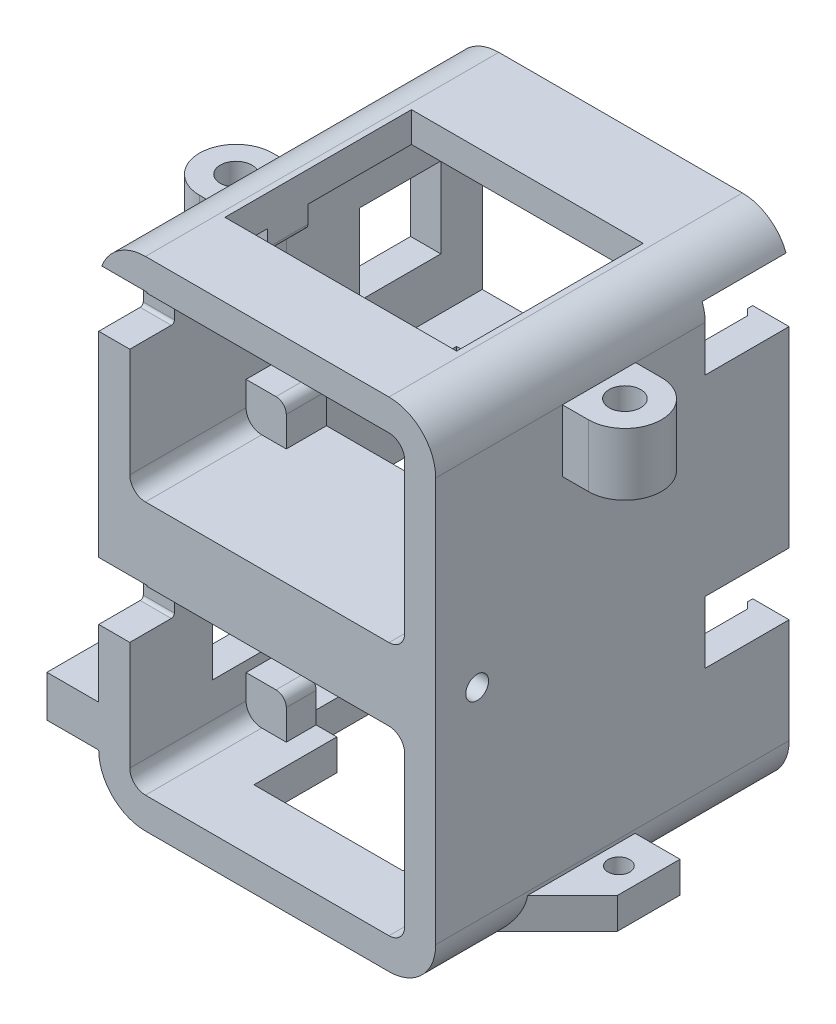
from build123d import *

# Parameters (mm, degrees)
EXTRUDE_2_DEPTH      = 11.22
EXTRUDE_3_DEPTH      = 3.88
CUT_EXTRUDE_1_DEPTH  = 4.65
SKETCH_8_R           = 3.525
SKETCH_8_R_2         = 1.525
EXTRUDE_5_DEPTH      = 6
SKETCH_9_W           = 22.36
SKETCH_9_H           = 3
CUT_EXTRUDE_3_DEPTH  = 8
SKETCH_10_W          = 21.46
SKETCH_10_H          = 6.88
CUT_EXTRUDE_4_DEPTH  = 1
CUT_EXTRUDE_5_DEPTH  = 8
EXTRUDE_7_DEPTH      = 3
SKETCH_15_W          = 26.7
SKETCH_15_H          = 42.2
EXTRUDE_42878_DEPTH  = 19
SKETCH_16_W          = 26.7
SKETCH_16_H          = 6.8
EXTRUDE_9_DEPTH      = 16
CUT_EXTRUDE_8_REACH  = 51.099
SKETCH_17_W          = 19.66
SKETCH_17_H          = 10
CUT_EXTRUDE_9_REACH  = 63.216
SKETCH_18_W          = 8.1
SKETCH_18_H          = 6
CUT_EXTRUDE_START    = -2.91
SKETCH_19_W          = 21.46
SKETCH_19_H          = 1
SKETCH_19_H_2        = 10
CUT_EXTRUDE_10_DEPTH = 2.91
CUT_EXTRUDE_14_REACH = 64.971
SKETCH_24_W          = 14
SKETCH_24_H          = 8
CUT_EXTRUDE_11_REACH = 64.971
SKETCH_20_W          = 22.36
SKETCH_20_H          = 10
SKETCH_21_W          = 1.5
SKETCH_21_H          = 5
EXTRUDE_10_DEPTH     = 0.6
CHAMFER_1_SIZE       = 1
CUT_EXTRUDE_12_REACH = 64.955
SKETCH_22_W          = 15
SKETCH_22_H          = 9.56
SKETCH_22_W_2        = 7.1
SKETCH_22_W_3        = 7.859919518
SKETCH_22_H_2        = 7.76
CUT_EXTRUDE_13_REACH = 64.971
SKETCH_23_W          = 0.38
SKETCH_23_H          = 8
SKETCH_25_R          = 1.05
EXTRUDE_48383_DEPTH  = 3
SKETCH_26_W          = 5
SKETCH_26_H          = 4
EXTRUDE_12_DEPTH     = 7
SKETCH_27_R          = 1.05
CUT_EXTRUDE_15_DEPTH = 57.74919682


with BuildPart() as part:
    # 草图2 → 凸台-拉伸2 (new body)
    with BuildSketch(Plane.XY):
        with BuildLine():
            ThreePointArc((-16.26, -7.25), (-14.939051583, -10.439051583), (-11.75, -11.76))
            Line((-11.75, -11.76), (11.75, -11.76))
            ThreePointArc((11.75, -11.76), (14.939051583, -10.439051583), (16.26, -7.25))
            Line((16.26, -7.25), (16.26, 31.75))
            ThreePointArc((16.26, 31.75), (14.939051583, 34.939051583), (11.75, 36.26))
            Line((11.75, 36.26), (-11.75, 36.26))
            ThreePointArc((-11.75, 36.26), (-14.939051583, 34.939051583), (-16.26, 31.75))
            Line((-16.26, 31.75), (-16.26, -7.25))
        make_face()
        with BuildLine():
            Line((13.26, 7.25), (13.26, -7.25))
            ThreePointArc((13.26, -7.25), (12.81773124, -8.31773124), (11.75, -8.76))
            Line((11.75, -8.76), (-11.75, -8.76))
            ThreePointArc((-11.75, -8.76), (-12.81773124, -8.31773124), (-13.26, -7.25))
            Line((-13.26, -7.25), (-13.26, 7.25))
            ThreePointArc((-13.26, 7.25), (-12.81773124, 8.31773124), (-11.75, 8.76))
            Line((-11.75, 8.76), (11.75, 8.76))
            ThreePointArc((11.75, 8.76), (12.81773124, 8.31773124), (13.26, 7.25))
        make_face(mode=Mode.SUBTRACT)
        with BuildLine():
            Line((-11.75, 33.26), (11.75, 33.26))
            ThreePointArc((11.75, 33.26), (12.81773124, 32.81773124), (13.26, 31.75))
            Line((13.26, 31.75), (13.26, 17.25))
            ThreePointArc((13.26, 17.25), (12.81773124, 16.18226876), (11.75, 15.74))
            Line((11.75, 15.74), (-11.75, 15.74))
            ThreePointArc((-11.75, 15.74), (-12.81773124, 16.18226876), (-13.26, 17.25))
            Line((-13.26, 17.25), (-13.26, 31.75))
            ThreePointArc((-13.26, 31.75), (-12.81773124, 32.81773124), (-11.75, 33.26))
        make_face(mode=Mode.SUBTRACT)
    extrude(amount=-EXTRUDE_2_DEPTH)

    # 草图3 → 凸台-拉伸3 (add)
    with BuildSketch(Plane(origin=(0, 0, -11.22), x_dir=(-1, 0, 0), z_dir=(0, 0, -1))):
        with BuildLine():
            ThreePointArc((11.75, -11.76), (14.939051583, -10.439051583), (16.26, -7.25))
            Line((16.26, -7.25), (16.26, 31.75))
            ThreePointArc((16.26, 31.75), (14.939051583, 34.939051583), (11.75, 36.26))
            Line((11.75, 36.26), (-11.75, 36.26))
            ThreePointArc((-11.75, 36.26), (-14.939051583, 34.939051583), (-16.26, 31.75))
            Line((-16.26, 31.75), (-16.26, -7.25))
            ThreePointArc((-16.26, -7.25), (-14.939051583, -10.439051583), (-11.75, -11.76))
            Line((-11.75, -11.76), (11.75, -11.76))
        make_face()
        with BuildLine():
            Line((13.26, -4.88), (10.37, -4.88))
            ThreePointArc((10.37, -4.88), (9.669964287, -5.169964287), (9.38, -5.87))
            Line((9.38, -5.87), (9.38, -8.76))
            Line((9.38, -8.76), (-9.38, -8.76))
            Line((-9.38, -8.76), (-9.38, -5.87))
            ThreePointArc((-9.38, -5.87), (-9.669964287, -5.169964287), (-10.37, -4.88))
            Line((-10.37, -4.88), (-13.26, -4.88))
            Line((-13.26, -4.88), (-13.26, 6.68))
            Line((-13.26, 6.68), (-11.67, 6.68))
            ThreePointArc((-11.67, 6.68), (-11.323517677, 6.823517677), (-11.18, 7.17))
            Line((-11.18, 7.17), (-11.18, 8.76))
            Line((-11.18, 8.76), (11.18, 8.76))
            Line((11.18, 8.76), (11.18, 7.17))
            ThreePointArc((11.18, 7.17), (11.323517677, 6.823517677), (11.67, 6.68))
            Line((11.67, 6.68), (13.26, 6.68))
            Line((13.26, 6.68), (13.26, -4.88))
        make_face(mode=Mode.SUBTRACT)
        with BuildLine():
            Line((13.26, 31.18), (13.26, 19.62))
            Line((13.26, 19.62), (10.37, 19.62))
            ThreePointArc((10.37, 19.62), (9.669964287, 19.330035713), (9.38, 18.63))
            Line((9.38, 18.63), (9.38, 15.74))
            Line((9.38, 15.74), (-9.38, 15.74))
            Line((-9.38, 15.74), (-9.38, 18.63))
            ThreePointArc((-9.38, 18.63), (-9.669964287, 19.330035713), (-10.37, 19.62))
            Line((-10.37, 19.62), (-13.26, 19.62))
            Line((-13.26, 19.62), (-13.26, 31.18))
            Line((-13.26, 31.18), (-11.67, 31.18))
            ThreePointArc((-11.67, 31.18), (-11.323517677, 31.323517677), (-11.18, 31.67))
            Line((-11.18, 31.67), (-11.18, 33.26))
            Line((-11.18, 33.26), (11.18, 33.26))
            Line((11.18, 33.26), (11.18, 31.67))
            ThreePointArc((11.18, 31.67), (11.323517677, 31.323517677), (11.67, 31.18))
            Line((11.67, 31.18), (13.26, 31.18))
        make_face(mode=Mode.SUBTRACT)
    extrude(amount=EXTRUDE_3_DEPTH)

    # 草图4 → 切除-拉伸1 (cut)
    with BuildSketch(Plane.ZY.offset(16.26)):
        with BuildLine():
            Line((0.1, 8.85), (-4, 8.85))
            ThreePointArc((-4, 8.85), (-4.212132034, 8.762132034), (-4.3, 8.55))
            Line((-4.3, 8.55), (-4.3, 3.55))
            ThreePointArc((-4.3, 3.55), (-4.212132034, 3.337867966), (-4, 3.25))
            Line((-4, 3.25), (0.1, 3.25))
            Line((0.1, 3.25), (0.1, 8.85))
        make_face()
        with BuildLine():
            Line((0.1, 33.35), (-4, 33.35))
            ThreePointArc((-4, 33.35), (-4.212132034, 33.262132034), (-4.3, 33.05))
            Line((-4.3, 33.05), (-4.3, 28.05))
            ThreePointArc((-4.3, 28.05), (-4.212132034, 27.837867966), (-4, 27.75))
            Line((-4, 27.75), (0.1, 27.75))
            Line((0.1, 27.75), (0.1, 33.35))
        make_face()
    extrude(amount=-CUT_EXTRUDE_1_DEPTH, mode=Mode.SUBTRACT)

    # 草图8 → 凸台-拉伸5 (add)
    # profile 1 of 3: a face of its own
    with BuildSketch(Plane(origin=(0, 31.75, 0), x_dir=(1, 0, 0), z_dir=(0, 1, 0))):
        with Locations((18.76, 15.755)):
            Circle(SKETCH_8_R)
        with Locations(Location((18.76, 15.755, 0), (0, 0, 270))):
            Circle(SKETCH_8_R_2, mode=Mode.SUBTRACT)
    # profile 2 of 3: a face of its own
    with BuildSketch(Plane(origin=(0, 31.75, 0), x_dir=(1, 0, 0), z_dir=(0, 1, 0))):
        with BuildLine():
            Line((15.235, 19.28), (15.235, 15.755))
            ThreePointArc((15.235, 15.755), (16.267448596, 18.247551404), (18.76, 19.28))
            Line((18.76, 19.28), (15.235, 19.28))
        make_face()
    # profile 3 of 3: a face of its own
    with BuildSketch(Plane(origin=(0, 31.75, 0), x_dir=(1, 0, 0), z_dir=(0, 1, 0))):
        with BuildLine():
            Line((15.235, 12.23), (18.76, 12.23))
            ThreePointArc((18.76, 12.23), (16.267448596, 13.262448596), (15.235, 15.755))
            Line((15.235, 15.755), (15.235, 12.23))
        make_face()
    extrude_5 = extrude(amount=-EXTRUDE_5_DEPTH)

    # 镜向1: 凸台-拉伸5 across plane
    add(extrude_5.mirror(Plane(origin=(0, 0, 0), x_dir=(0, 0, 1), z_dir=(1, 0, 0))))

    # 草图9 → 切除-拉伸3 (cut)
    with BuildSketch(Plane(origin=(0, 0, -15.1), x_dir=(-1, 0, 0), z_dir=(0, 0, -1))):
        with Locations((0, 34.76)):
            Rectangle(SKETCH_9_W, SKETCH_9_H)
    extrude(amount=-CUT_EXTRUDE_3_DEPTH, mode=Mode.SUBTRACT)

    # 草图10 → 切除-拉伸4 (cut)
    with BuildSketch(Plane(origin=(0, 0, -15.1), x_dir=(-1, 0, 0), z_dir=(0, 0, -1))):
        with Locations((0, -8.32)):
            Rectangle(SKETCH_10_W, SKETCH_10_H)
    extrude(amount=-CUT_EXTRUDE_4_DEPTH, mode=Mode.SUBTRACT)

    # 草图12 → 切除-拉伸5 (cut)
    with BuildSketch(Plane.ZY.offset(16.26)):
        with BuildLine():
            ThreePointArc((-2.9, 12.25), (-4, 13.35), (-5.1, 12.25))
            Line((-5.1, 12.25), (-2.9, 12.25))
        make_face()
        with BuildLine():
            Line((-2.9, 12.25), (-5.1, 12.25))
            ThreePointArc((-5.1, 12.25), (-4, 11.15), (-2.9, 12.25))
        make_face()
    cut_extrude_5 = extrude(amount=-CUT_EXTRUDE_5_DEPTH, mode=Mode.SUBTRACT)

    # 镜向2: 切除-拉伸5 across plane
    add(cut_extrude_5.mirror(Plane(origin=(0, 0, 0), x_dir=(0, 0, 1), z_dir=(1, 0, 0))), mode=Mode.SUBTRACT)

    # 草图14 → 凸台-拉伸7 (add)
    with BuildSketch(Plane(origin=(0, 0, -15.1), x_dir=(-1, 0, 0), z_dir=(0, 0, -1))):
        with BuildLine():
            Line((-16.26, 19.53), (-16.26, 8.85))
            Line((-16.26, 8.85), (-9.83, 8.85))
            Line((-9.83, 8.85), (-9.83, 19.459759001))
            ThreePointArc((-9.83, 19.459759001), (-9.892490797, 19.497228321), (-9.957568187, 19.53))
            Line((-9.957568187, 19.53), (-16.26, 19.53))
        make_face()
        with BuildLine():
            Line((9.83, 8.85), (16.26, 8.85))
            Line((16.26, 8.85), (16.26, 19.53))
            Line((16.26, 19.53), (9.957568187, 19.53))
            ThreePointArc((9.957568187, 19.53), (9.892490797, 19.497228321), (9.83, 19.459759001))
            Line((9.83, 19.459759001), (9.83, 8.85))
        make_face()
    extrude(amount=EXTRUDE_7_DEPTH)

    # 草图15 → Extrude 42878 (add)
    with BuildSketch(Plane(origin=(0, 0, -15.1), x_dir=(-1, 0, 0), z_dir=(0, 0, -1))):
        with BuildLine():
            Line((-16.26, 31.75), (-16.26, 19.53))
            Line((-16.26, 19.53), (-16.26, 8.85))
            Line((-16.26, 8.85), (-16.26, -7.25))
            ThreePointArc((-16.26, -7.25), (-14.939051583, -10.439051583), (-11.75, -11.76))
            Line((-11.75, -11.76), (11.75, -11.76))
            ThreePointArc((11.75, -11.76), (14.939051583, -10.439051583), (16.26, -7.25))
            Line((16.26, -7.25), (16.26, 8.85))
            Line((16.26, 8.85), (16.26, 19.53))
            Line((16.26, 19.53), (16.26, 31.75))
            ThreePointArc((16.26, 31.75), (14.939051583, 34.939051583), (11.75, 36.26))
            Line((11.75, 36.26), (-11.75, 36.26))
            ThreePointArc((-11.75, 36.26), (-14.939051583, 34.939051583), (-16.26, 31.75))
        make_face()
        with Locations((0, 12.25)):
            Rectangle(SKETCH_15_W, SKETCH_15_H, mode=Mode.SUBTRACT)
    extrude(amount=EXTRUDE_42878_DEPTH)

    # 草图16 → 凸台-拉伸9 (add)
    with BuildSketch(Plane(origin=(0, 0, -18.1), x_dir=(-1, 0, 0), z_dir=(0, 0, -1))):
        with Locations((0, 12.25)):
            Rectangle(SKETCH_16_W, SKETCH_16_H)
    extrude(amount=EXTRUDE_9_DEPTH)

    # 草图17 → 切除-拉伸8 (cut, up to next)
    with BuildSketch(Plane.XZ.offset(-8.85), mode=Mode.PRIVATE) as cut_extrude_8_sk1:
        with Locations((0, -23.1)):
            Rectangle(SKETCH_17_W, SKETCH_17_H)
    cut_extrude_8_tool1 = extrude(cut_extrude_8_sk1.sketch, amount=-CUT_EXTRUDE_8_REACH, mode=Mode.PRIVATE) & part.part
    add(cut_extrude_8_tool1.solids().sort_by_distance((0, 8.85, -23.1))[0], mode=Mode.SUBTRACT)

    # 草图18 → 切除-拉伸9 (cut, up to next)
    with BuildSketch(Plane.ZY.offset(-13.35), mode=Mode.PRIVATE) as cut_extrude_9_sk1:
        with Locations((-30.05, 5.85)):
            Rectangle(SKETCH_18_W, SKETCH_18_H)
    cut_extrude_9_tool1 = extrude(cut_extrude_9_sk1.sketch, amount=-CUT_EXTRUDE_9_REACH, mode=Mode.PRIVATE) & part.part
    # 草图18 → 切除-拉伸9 (cut, up to next)
    with BuildSketch(Plane.ZY.offset(-13.35), mode=Mode.PRIVATE) as cut_extrude_9_sk2:
        with Locations((-30.05, 30.35)):
            Rectangle(SKETCH_18_W, SKETCH_18_H)
    cut_extrude_9_tool2 = extrude(cut_extrude_9_sk2.sketch, amount=-CUT_EXTRUDE_9_REACH, mode=Mode.PRIVATE) & part.part
    add(cut_extrude_9_tool1.solids().sort_by_distance((13.35, 5.85, -30.05))[0], mode=Mode.SUBTRACT)
    add(cut_extrude_9_tool2.solids().sort_by_distance((13.35, 30.35, -30.05))[0], mode=Mode.SUBTRACT)

    # 草图19 → 切除-拉伸10 (cut)
    with BuildSketch(Plane.XZ.offset(11.76).offset(CUT_EXTRUDE_START)):
        with Locations((0, -14.6)):
            Rectangle(SKETCH_19_W, SKETCH_19_H)
        with Locations((0, -20.1)):
            Rectangle(SKETCH_19_W, SKETCH_19_H_2)
    extrude(amount=CUT_EXTRUDE_10_DEPTH, mode=Mode.SUBTRACT)

    # 草图24 → 切除-拉伸14 (cut, up to next)
    with BuildSketch(Plane.XZ.offset(11.76), mode=Mode.PRIVATE) as cut_extrude_14_sk1:
        with Locations((0, -10.1)):
            Rectangle(SKETCH_24_W, SKETCH_24_H)
    cut_extrude_14_tool1 = extrude(cut_extrude_14_sk1.sketch, amount=-CUT_EXTRUDE_14_REACH, mode=Mode.PRIVATE) & part.part
    add(cut_extrude_14_tool1.solids().sort_by_distance((0, -11.76, -10.1))[0], mode=Mode.SUBTRACT)

    # 草图20 → 切除-拉伸11 (cut, up to next)
    with BuildSketch(Plane(origin=(0, 36.26, 0), x_dir=(1, 0, 0), z_dir=(0, 1, 0)), mode=Mode.PRIVATE) as cut_extrude_11_sk1:
        with Locations((0, 20.1)):
            Rectangle(SKETCH_20_W, SKETCH_20_H)
    cut_extrude_11_tool1 = extrude(cut_extrude_11_sk1.sketch, amount=-CUT_EXTRUDE_11_REACH, mode=Mode.PRIVATE) & part.part
    add(cut_extrude_11_tool1.solids().sort_by_distance((0, 36.26, -20.1))[0], mode=Mode.SUBTRACT)

    # 草图21 → 凸台-拉伸10 (add)
    with BuildSketch(Plane.ZY.offset(-13.35)):
        with Locations((-33.35, 24.85)):
            Rectangle(SKETCH_21_W, SKETCH_21_H)
        with Locations((-33.35, 0.35)):
            Rectangle(SKETCH_21_W, SKETCH_21_H)
    extrude(amount=EXTRUDE_10_DEPTH)

    # 倒角1
    # the kernel refuses this chamfer: 1 mm, written as the material it takes off along each edge
    with BuildSketch(Plane(origin=(12.75, 5.421682988, -32.6), x_dir=(-0.02749587661058555, 0, -0.9996219169112968), z_dir=(0, -1, 0))) as chamfer_1_piece_1_section:
        Polygon((CHAMFER_1_SIZE * 0.999621916911, CHAMFER_1_SIZE * 0.0274958766106), (-CHAMFER_1_SIZE * 0.0274958766106, CHAMFER_1_SIZE * 0.999621916911), (0, 0), align=None)
    chamfer_1_piece_1 = extrude(amount=10.143365976, mode=Mode.PRIVATE)
    chamfer_1_piece_1 = split(chamfer_1_piece_1, bisect_by=Plane(origin=(13.35, 0.35, -32.97500946), z_dir=(-1, 0, 0)), keep=Keep.TOP, mode=Mode.PRIVATE)
    add(chamfer_1_piece_1, mode=Mode.SUBTRACT)
    with BuildSketch(Plane(origin=(12.75, 29.921682988, -32.6), x_dir=(-0.02749587661058555, 0, -0.9996219169112968), z_dir=(0, -1, 0))) as chamfer_1_piece_2_section:
        Polygon((CHAMFER_1_SIZE * 0.999621916911, CHAMFER_1_SIZE * 0.0274958766106), (-CHAMFER_1_SIZE * 0.0274958766106, CHAMFER_1_SIZE * 0.999621916911), (0, 0), align=None)
    chamfer_1_piece_2 = extrude(amount=10.143365976, mode=Mode.PRIVATE)
    chamfer_1_piece_2 = split(chamfer_1_piece_2, bisect_by=Plane(origin=(13.35, 24.85, -32.97500946), z_dir=(-1, 0, 0)), keep=Keep.TOP, mode=Mode.PRIVATE)
    add(chamfer_1_piece_2, mode=Mode.SUBTRACT)

    # 草图22 → 切除-拉伸12 (cut, up to next)
    with BuildSketch(Plane.ZY.offset(16.26), mode=Mode.PRIVATE) as cut_extrude_12_sk1:
        with Locations((-22.6, 0.9)):
            Rectangle(SKETCH_22_W, SKETCH_22_H)
    cut_extrude_12_tool1 = extrude(cut_extrude_12_sk1.sketch, amount=-CUT_EXTRUDE_12_REACH, mode=Mode.PRIVATE) & part.part
    # 草图22 → 切除-拉伸12 (cut, up to next)
    with BuildSketch(Plane.ZY.offset(16.26), mode=Mode.PRIVATE) as cut_extrude_12_sk2:
        with Locations((-11.55, 0.9)):
            Rectangle(SKETCH_22_W_2, SKETCH_22_H)
    cut_extrude_12_tool2 = extrude(cut_extrude_12_sk2.sketch, amount=-CUT_EXTRUDE_12_REACH, mode=Mode.PRIVATE) & part.part
    # 草图22 → 切除-拉伸12 (cut, up to next)
    with BuildSketch(Plane.ZY.offset(16.26), mode=Mode.PRIVATE) as cut_extrude_12_sk3:
        with Locations((-26.170040241, 24.5)):
            Rectangle(SKETCH_22_W_3, SKETCH_22_H_2)
    cut_extrude_12_tool3 = extrude(cut_extrude_12_sk3.sketch, amount=-CUT_EXTRUDE_12_REACH, mode=Mode.PRIVATE) & part.part
    add(cut_extrude_12_tool1.solids().sort_by_distance((-16.26, 0.9, -22.6))[0], mode=Mode.SUBTRACT)
    add(cut_extrude_12_tool2.solids().sort_by_distance((-16.26, 0.9, -11.55))[0], mode=Mode.SUBTRACT)
    add(cut_extrude_12_tool3.solids().sort_by_distance((-16.26, 24.5, -26.17004))[0], mode=Mode.SUBTRACT)

    # 草图23 → 切除-拉伸13 (cut, up to next)
    with BuildSketch(Plane.XZ.offset(11.76), mode=Mode.PRIVATE) as cut_extrude_13_sk1:
        with Locations((-7.19, -10.1)):
            Rectangle(SKETCH_23_W, SKETCH_23_H)
    cut_extrude_13_tool1 = extrude(cut_extrude_13_sk1.sketch, amount=-CUT_EXTRUDE_13_REACH, mode=Mode.PRIVATE) & part.part
    add(cut_extrude_13_tool1.solids().sort_by_distance((-7.19, -11.76, -10.1))[0], mode=Mode.SUBTRACT)

    # 草图25 → Extrude 48383 (add)
    with BuildSketch(Plane(origin=(0, -10.58, 0), x_dir=(1, 0, 0), z_dir=(0, 1, 0))):
        Polygon((20.58, 19.255), (14.58, 19.255), (14.58, 7.205252532), (20.58, 13.205252532), align=None)
        with Locations(Location((18.18, 15.755, 0), (0, 0, 180))):
            Circle(SKETCH_25_R, mode=Mode.SUBTRACT)
    extrude(amount=EXTRUDE_48383_DEPTH)

    # 草图26 → 凸台-拉伸12 (add)
    with BuildSketch(Plane.XY):
        with Locations((-18.76, -5.25)):
            Rectangle(SKETCH_26_W, SKETCH_26_H)
    extrude(amount=-EXTRUDE_12_DEPTH)

    # 草图27 → 切除-拉伸15 (cut, through all)
    with BuildSketch(Plane(origin=(0, -3.25, 0), x_dir=(1, 0, 0), z_dir=(0, 1, 0))):
        with Locations(Location((-17.76, 3.5, 0), (0, 0, 180))):
            Circle(SKETCH_27_R)
    extrude(amount=-CUT_EXTRUDE_15_DEPTH, mode=Mode.SUBTRACT)


solid = part.part
